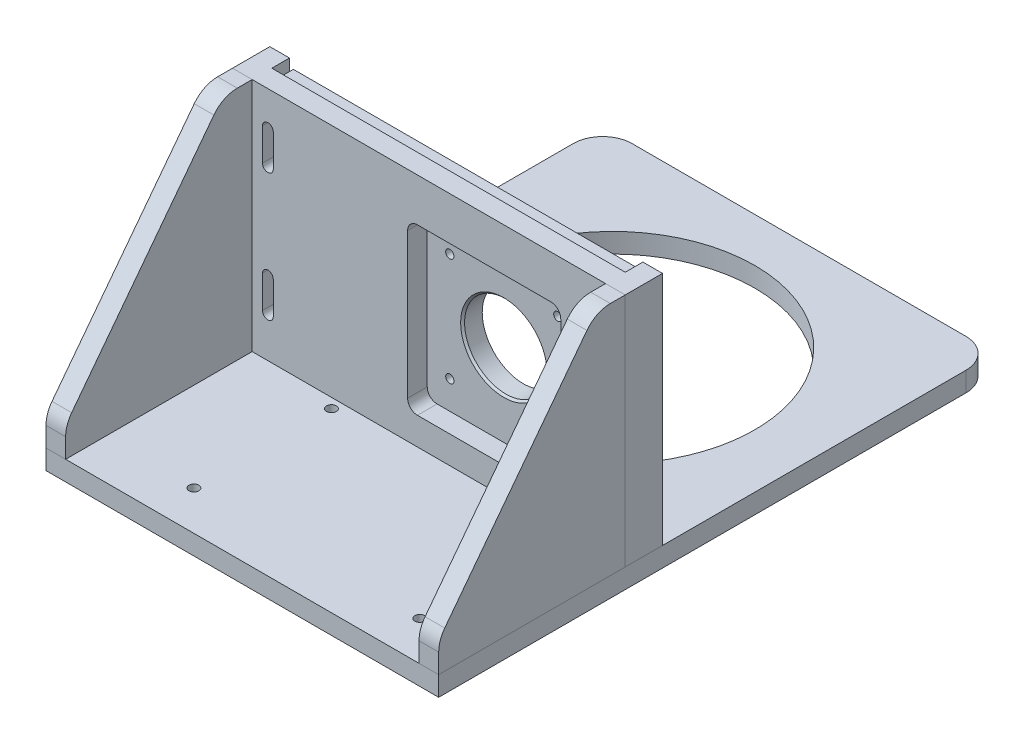
from build123d import *

# Parameters (mm, degrees)
SKETCH1_W                                            = 200
SKETCH1_H                                            = 283.5
SKETCH1_R                                            = 72.5
SKETCH1_R_2                                          = 0.5
BOSS_EXTRUDE1_DEPTH                                  = 10
M6_TAPPED_HOLE1_D                                    = 5
CSK_FOR_M5_HEX_SOCKET_COUNTERSUNK_CAP_SC_D           = 5.5
CSK_FOR_M5_HEX_SOCKET_COUNTERSUNK_CAP_SC_CSINK_D     = 11.2
CSK_FOR_M5_HEX_SOCKET_COUNTERSUNK_CAP_SC_CSINK_ANGLE = 90
SKETCH7_W                                            = 200
SKETCH7_H                                            = 10
BOSS_EXTRUDE2_DEPTH                                  = 120
BOSS_EXTRUDE3_DEPTH                                  = 10
SKETCH22_W                                           = 10
SKETCH22_H                                           = 120
BOSS_EXTRUDE4_DEPTH                                  = 10
SKETCH12_W                                           = 2.25
SKETCH12_H                                           = 115
M4_CLEARANCE_HOLE1_AT_2_COUNT                        = 2
M4_CLEARANCE_HOLE1_AT_2_PITCH                        = 45
M4_CLEARANCE_HOLE1_AT_3_COUNT                        = 2
M4_CLEARANCE_HOLE1_AT_3_PITCH                        = 90
CSK_FOR_M4_HEX_SOCKET_COUNTERSUNK_CA_2_COUNT         = 2
CSK_FOR_M4_HEX_SOCKET_COUNTERSUNK_CA_2_PITCH         = 35
CSK_FOR_M4_HEX_SOCKET_COUNTERSUNK_CA_3_COUNT         = 2
CSK_FOR_M4_HEX_SOCKET_COUNTERSUNK_CA_3_PITCH         = 70
M4_TAPPED_HOLE1_AT_2_COUNT                           = 2
M4_TAPPED_HOLE1_AT_2_PITCH                           = 45
M4_TAPPED_HOLE1_AT_3_COUNT                           = 2
M4_TAPPED_HOLE1_AT_3_PITCH                           = 90
M4_TAPPED_HOLE2_AT_2_COUNT                           = 2
M4_TAPPED_HOLE2_AT_2_PITCH                           = 35
M4_TAPPED_HOLE2_AT_3_COUNT                           = 2
M4_TAPPED_HOLE2_AT_3_PITCH                           = 70
M5_TAPPED_HOLE1_AT_2_COUNT                           = 2
M5_TAPPED_HOLE1_AT_2_PITCH                           = 75
M5_TAPPED_HOLE1_AT_3_COUNT                           = 2
M5_TAPPED_HOLE1_AT_3_PITCH                           = 150
FILLET2_R                                            = 15
MIRROR2_COPY_1_SKETCH_W                              = 2.25
MIRROR2_COPY_1_SKETCH_H                              = 115
MIRROR2_COPY_2_SKETCH_W                              = 2.25
MIRROR2_COPY_2_SKETCH_H                              = 115
SKETCH21_W                                           = 78
SKETCH21_H                                           = 84
CUT_EXTRUDE1_DEPTH                                   = 250.86446326
SKETCH23_W                                           = 180
SKETCH23_H                                           = 110
BOSS_EXTRUDE5_DEPTH                                  = 10
M5_START                                             = 83.5
M5_CLEARANCE_SLOT1_DEPTH                             = 10
SKETCH27_W                                           = 2.1
SKETCH27_H                                           = 178.5
M5_TAPPED_HOLE2_AT_2_COUNT                           = 2
M5_TAPPED_HOLE2_AT_2_PITCH                           = 65
M5_TAPPED_HOLE2_AT_3_COUNT                           = 2
M5_TAPPED_HOLE2_AT_3_PITCH                           = 164
M5_TAPPED_HOLE2_AT_4_COUNT                           = 2
M5_TAPPED_HOLE2_AT_4_PITCH                           = 176.411450876
CSK_FOR_M6_HEX_SOCKET_COUNTERSUNK_CA_2_COUNT         = 2
CSK_FOR_M6_HEX_SOCKET_COUNTERSUNK_CA_2_PITCH         = 95.25
CSK_FOR_M6_HEX_SOCKET_COUNTERSUNK_CA_3_COUNT         = 2
CSK_FOR_M6_HEX_SOCKET_COUNTERSUNK_CA_3_PITCH         = 118.205594199
CSK_FOR_M6_HEX_SOCKET_COUNTERSUNK_CA_4_COUNT         = 2
CSK_FOR_M6_HEX_SOCKET_COUNTERSUNK_CA_4_PITCH         = 70
SKETCH32_W                                           = 2.1
SKETCH32_H                                           = 178.5
M5_TAPPED_HOLE3_AT_2_COUNT                           = 2
M5_TAPPED_HOLE3_AT_2_PITCH                           = 55
M5_TAPPED_HOLE3_AT_3_COUNT                           = 2
M5_TAPPED_HOLE3_AT_3_PITCH                           = 55
M5_TAPPED_HOLE3_AT_4_COUNT                           = 2
M5_TAPPED_HOLE3_AT_4_PITCH                           = 77.781745931
SKETCH33_R                                           = 21
CUT_EXTRUDE2_DEPTH                                   = 243.409261374
SKETCH35_W                                           = 3
SKETCH35_H                                           = 178.5
F_6_0MM_DOWEL_HOLE1_AT_2_COUNT                       = 2
F_6_0MM_DOWEL_HOLE1_AT_2_PITCH                       = 95.25
FILLET1_R                                            = 15
FILLET3_R                                            = 5
CHAMFER1_SIZE                                        = 1
CHAMFER2_SIZE                                        = 1
CHAMFER3_SIZE                                        = 1
CHAMFER4_SIZE                                        = 1


# Read off the part's stored shape, not the designer's step: M5 Clearance Slot1
with BuildPart() as part:
    # Sketch1 → Boss-Extrude1 (new body)
    with BuildSketch(Plane(origin=(0, 0, 0), x_dir=(1, 0, 0), z_dir=(0, 1, 0))):
        with Locations((0, -46.75)):
            Rectangle(SKETCH1_W, SKETCH1_H)
        with Locations(Location((0, 0, 0), (0, 0, 270))):
            Circle(SKETCH1_R, mode=Mode.SUBTRACT)
        with Locations(Location((-44.65, -168.5, 0), (0, 0, 270))):
            Circle(SKETCH1_R_2, mode=Mode.SUBTRACT)
        with Locations(Location((70.35, -168.5, 0), (0, 0, 270))):
            Circle(SKETCH1_R_2, mode=Mode.SUBTRACT)
        with Locations(Location((70.35, -98.5, 0), (0, 0, 270))):
            Circle(SKETCH1_R_2, mode=Mode.SUBTRACT)
        with Locations(Location((-44.65, -98.5, 0), (0, 0, 270))):
            Circle(SKETCH1_R_2, mode=Mode.SUBTRACT)
    extrude(amount=BOSS_EXTRUDE1_DEPTH)

    # M6 Tapped Hole1 (through all)
    with Locations(Plane(origin=(0, 10, 0), x_dir=(1, 0, 0), z_dir=(0, 1, 0))):
        with Locations((-44.65, -98.5), (-44.65, -168.5), (70.35, -168.5), (70.35, -98.5)):
            Hole(M6_TAPPED_HOLE1_D / 2)

    # CSK for M5 Hex Socket Countersunk Cap Screw2 (through all)
    with Locations(Plane(origin=(0, 0, 0), x_dir=(-1, 0, 0), z_dir=(0, -1, 0))):
        with Locations((0, -88.5), (75, -88.5), (-75, -88.5)):
            CounterSinkHole(CSK_FOR_M5_HEX_SOCKET_COUNTERSUNK_CAP_SC_D / 2, CSK_FOR_M5_HEX_SOCKET_COUNTERSUNK_CAP_SC_CSINK_D / 2, counter_sink_angle=CSK_FOR_M5_HEX_SOCKET_COUNTERSUNK_CAP_SC_CSINK_ANGLE)

    # Sketch14 → CSK for M4 Hex Socket Countersunk Cap Screw1 (revolve, cut)
    with BuildSketch(Plane(origin=(-95, 0, 178.5), x_dir=(0, 0, -1), z_dir=(1, 0, 0))):
        Polygon((0, 0), (0, 130), (2.25, 130), (2.25, 2.23), (4.48, 0), align=None)
    csk_for_m4_hex_socket_countersunk_cap_sc = revolve(axis=Axis((-95, -6.35, 178.5), (0, 1, 0)), mode=Mode.SUBTRACT)

    # CSK for M4 Hex Socket Countersunk Ca 2: CSK for M4 Hex Socket Countersunk Cap Screw1 ×2
    with Locations(*[(0, 0, -i * CSK_FOR_M4_HEX_SOCKET_COUNTERSUNK_CA_2_PITCH) for i in range(1, CSK_FOR_M4_HEX_SOCKET_COUNTERSUNK_CA_2_COUNT)]):
        add(csk_for_m4_hex_socket_countersunk_cap_sc, mode=Mode.SUBTRACT)

    # CSK for M4 Hex Socket Countersunk Ca 3: CSK for M4 Hex Socket Countersunk Cap Screw1 ×2
    with Locations(*[(0, 0, -i * CSK_FOR_M4_HEX_SOCKET_COUNTERSUNK_CA_3_PITCH) for i in range(1, CSK_FOR_M4_HEX_SOCKET_COUNTERSUNK_CA_3_COUNT)]):
        add(csk_for_m4_hex_socket_countersunk_cap_sc, mode=Mode.SUBTRACT)


with BuildPart() as body_2:
    # Sketch7 → Boss-Extrude2 (new body)
    with BuildSketch(Plane(origin=(0, 10, 0), x_dir=(1, 0, 0), z_dir=(0, 1, 0))):
        with Locations((0, -88.5)):
            Rectangle(SKETCH7_W, SKETCH7_H)
    extrude(amount=BOSS_EXTRUDE2_DEPTH)

    # Sketch22 → Boss-Extrude4 (add)
    with BuildSketch(Plane(origin=(0, 0, 83.5), x_dir=(-1, 0, 0), z_dir=(0, 0, -1))):
        with Locations((95, 70)):
            Rectangle(SKETCH22_W, SKETCH22_H)
    boss_extrude4 = extrude(amount=BOSS_EXTRUDE4_DEPTH)

    # Sketch12 → M4 Clearance Hole1 (revolve, cut)
    with BuildSketch(Plane(origin=(-95, 115, 73.5), x_dir=(0, 1, 0), z_dir=(1, 0, 0))):
        with Locations((1.125, 57.5)):
            Rectangle(SKETCH12_W, SKETCH12_H)
    m4_clearance_hole1 = revolve(axis=Axis((-95, 115, 67.15), (0, 0, 1)), mode=Mode.SUBTRACT)

    # M4 Clearance Hole1 at 2: M4 Clearance Hole1 ×2
    with Locations(*[(0, -i * M4_CLEARANCE_HOLE1_AT_2_PITCH, 0) for i in range(1, M4_CLEARANCE_HOLE1_AT_2_COUNT)]):
        add(m4_clearance_hole1, mode=Mode.SUBTRACT)

    # M4 Clearance Hole1 at 3: M4 Clearance Hole1 ×2
    with Locations(*[(0, -i * M4_CLEARANCE_HOLE1_AT_3_PITCH, 0) for i in range(1, M4_CLEARANCE_HOLE1_AT_3_COUNT)]):
        add(m4_clearance_hole1, mode=Mode.SUBTRACT)

    # Sketch20 → M5 Tapped Hole1 (revolve, cut)
    with BuildSketch(Plane(origin=(-75, 10, 88.5), x_dir=(0, 0, -1), z_dir=(1, 0, 0))):
        Polygon((0, 0), (0, 13.6618073), (2.1, 12.4), (2.1, 0), align=None)
    m5_tapped_hole1 = revolve(axis=Axis((-75, 3.65, 88.5), (0, 1, 0)), mode=Mode.SUBTRACT)

    # M5 Tapped Hole1 at 2: M5 Tapped Hole1 ×2
    with Locations(*[(i * M5_TAPPED_HOLE1_AT_2_PITCH, 0, 0) for i in range(1, M5_TAPPED_HOLE1_AT_2_COUNT)]):
        add(m5_tapped_hole1, mode=Mode.SUBTRACT)

    # M5 Tapped Hole1 at 3: M5 Tapped Hole1 ×2
    with Locations(*[(i * M5_TAPPED_HOLE1_AT_3_PITCH, 0, 0) for i in range(1, M5_TAPPED_HOLE1_AT_3_COUNT)]):
        add(m5_tapped_hole1, mode=Mode.SUBTRACT)

    # Mirror3: Boss-Extrude4 across plane
    add(boss_extrude4.mirror(Plane(origin=(0, 0, 0), x_dir=(0, 0, 1), z_dir=(1, 0, 0))))


with BuildPart() as body_3:
    # Sketch10 → Boss-Extrude3 (new body)
    with BuildSketch(Plane.ZY.offset(100)):
        Polygon((93.5, 130), (93.5, 10), (188.5, 10), (188.5, 25), (108.5, 130), align=None)
    extrude(amount=-BOSS_EXTRUDE3_DEPTH)

    # Sketch16 → M4 Tapped Hole1 (revolve, cut)
    with BuildSketch(Plane(origin=(-95, 115, 93.5), x_dir=(0, 1, 0), z_dir=(1, 0, 0))):
        Polygon((0, 0), (0, 11.091420021), (1.65, 10.1), (1.65, 0), align=None)
    m4_tapped_hole1 = revolve(axis=Axis((-95, 115, 87.15), (0, 0, 1)), mode=Mode.SUBTRACT)

    # M4 Tapped Hole1 at 2: M4 Tapped Hole1 ×2
    with Locations(*[(0, -i * M4_TAPPED_HOLE1_AT_2_PITCH, 0) for i in range(1, M4_TAPPED_HOLE1_AT_2_COUNT)]):
        add(m4_tapped_hole1, mode=Mode.SUBTRACT)

    # M4 Tapped Hole1 at 3: M4 Tapped Hole1 ×2
    with Locations(*[(0, -i * M4_TAPPED_HOLE1_AT_3_PITCH, 0) for i in range(1, M4_TAPPED_HOLE1_AT_3_COUNT)]):
        add(m4_tapped_hole1, mode=Mode.SUBTRACT)

    # Sketch18 → M4 Tapped Hole2 (revolve, cut)
    with BuildSketch(Plane(origin=(-95, 10, 108.5), x_dir=(0, 0, -1), z_dir=(1, 0, 0))):
        Polygon((0, 0), (0, 11.091420021), (1.65, 10.1), (1.65, 0), align=None)
    m4_tapped_hole2 = revolve(axis=Axis((-95, 3.65, 108.5), (0, 1, 0)), mode=Mode.SUBTRACT)

    # M4 Tapped Hole2 at 2: M4 Tapped Hole2 ×2
    with Locations(*[(0, 0, i * M4_TAPPED_HOLE2_AT_2_PITCH) for i in range(1, M4_TAPPED_HOLE2_AT_2_COUNT)]):
        add(m4_tapped_hole2, mode=Mode.SUBTRACT)

    # M4 Tapped Hole2 at 3: M4 Tapped Hole2 ×2
    with Locations(*[(0, 0, i * M4_TAPPED_HOLE2_AT_3_PITCH) for i in range(1, M4_TAPPED_HOLE2_AT_3_COUNT)]):
        add(m4_tapped_hole2, mode=Mode.SUBTRACT)

    # Fillet2
    fillet2_edges = [body_3.edges().sort_by_distance(p)[0] for p in [
        (-95, 130, 108.5),
        (-95, 25, 188.5),
    ]]
    fillet(fillet2_edges, radius=FILLET2_R)


with BuildPart() as body_4:
    # Mirror1: mirrored copy
    add(body_3.part.mirror(Plane(origin=(0, 0, 0), x_dir=(0, 0, 1), z_dir=(1, 0, 0))))


with BuildPart() as mirror2_tool:
    # Mirror2: M4 Clearance Hole1, CSK for M4 Hex Socket Countersunk Cap Screw1 across plane
    add(m4_clearance_hole1.mirror(Plane(origin=(0, 0, 0), x_dir=(0, 0, 1), z_dir=(1, 0, 0))))
    add(csk_for_m4_hex_socket_countersunk_cap_sc.mirror(Plane(origin=(0, 0, 0), x_dir=(0, 0, 1), z_dir=(1, 0, 0))))


with BuildPart() as body_2_1:
    add(body_2.part)

    # Mirror2: cut by mirror2_tool
    add(mirror2_tool.part, mode=Mode.SUBTRACT)

    # Mirror2 copy 1 sketch → Mirror2 copy 1 (revolve, cut)
    with BuildSketch(Plane(origin=(95, 70, 73.5), x_dir=(0, 1, 0), z_dir=(-1, 0, 0))):
        with Locations((1.125, -57.5)):
            Rectangle(MIRROR2_COPY_1_SKETCH_W, MIRROR2_COPY_1_SKETCH_H)
    revolve(axis=Axis((95, 70, 67.15), (0, 0, -1)), mode=Mode.SUBTRACT)

    # Mirror2 copy 2 sketch → Mirror2 copy 2 (revolve, cut)
    with BuildSketch(Plane(origin=(95, 25, 73.5), x_dir=(0, 1, 0), z_dir=(-1, 0, 0))):
        with Locations((1.125, -57.5)):
            Rectangle(MIRROR2_COPY_2_SKETCH_W, MIRROR2_COPY_2_SKETCH_H)
    revolve(axis=Axis((95, 25, 67.15), (0, 0, -1)), mode=Mode.SUBTRACT)

    # Sketch21 → Cut-Extrude1 (cut, through all)
    with BuildSketch(Plane.XY.offset(93.5)):
        with Locations((28.17, 66)):
            Rectangle(SKETCH21_W, SKETCH21_H)
    extrude(amount=-CUT_EXTRUDE1_DEPTH, mode=Mode.SUBTRACT)

    # M5 Clearance Slot1 outline → M5 Clearance Slot1 (cut)
    with BuildSketch(Plane.XY.offset(M5_START)):
        with BuildLine():
            Line((-79.25, 30.75), (-79.25, 47.25))
            ThreePointArc((-79.25, 47.25), (-82, 50), (-84.75, 47.25))
            Line((-84.75, 47.25), (-84.75, 30.75))
            ThreePointArc((-84.75, 30.75), (-82, 28), (-79.25, 30.75))
        make_face()
        with BuildLine():
            ThreePointArc((-79.25, 112.25), (-82, 115), (-84.75, 112.25))
            Line((-84.75, 112.25), (-84.75, 95.75))
            ThreePointArc((-84.75, 95.75), (-82, 93), (-79.25, 95.75))
            Line((-79.25, 95.75), (-79.25, 112.25))
        make_face()
        with BuildLine():
            Line((84.75, 30.75), (84.75, 47.25))
            ThreePointArc((84.75, 47.25), (82, 50), (79.25, 47.25))
            Line((79.25, 47.25), (79.25, 30.75))
            ThreePointArc((79.25, 30.75), (82, 28), (84.75, 30.75))
        make_face()
        with BuildLine():
            ThreePointArc((84.75, 112.25), (82, 115), (79.25, 112.25))
            Line((79.25, 112.25), (79.25, 95.75))
            ThreePointArc((79.25, 95.75), (82, 93), (84.75, 95.75))
            Line((84.75, 95.75), (84.75, 112.25))
        make_face()
    extrude(amount=M5_CLEARANCE_SLOT1_DEPTH, mode=Mode.SUBTRACT)

    # Fillet3
    fillet3_edges = [body_2_1.edges().sort_by_distance(p)[0] for p in [
        (-10.83, 24, 88.5),
        (-10.83, 108, 88.5),
        (67.17, 108, 88.5),
        (67.17, 24, 88.5),
    ]]
    fillet(fillet3_edges, radius=FILLET3_R)

    # Chamfer2
    chamfer2_edges = [body_2_1.edges().sort_by_distance(p)[0] for p in [
        (-100, 70, 73.5),
        (-90, 70, 73.5),
        (100, 70, 73.5),
        (90, 70, 73.5),
    ]]
    chamfer(chamfer2_edges, length=CHAMFER2_SIZE)

    # Chamfer4
    chamfer4_edges = [body_2_1.edges().sort_by_distance(p)[0] for p in [
        (-95, 130, 73.5),
        (95, 130, 73.5),
    ]]
    chamfer(chamfer4_edges, length=CHAMFER4_SIZE)


with BuildPart() as part_1:
    add(part.part)

    # Mirror2: cut by mirror2_tool
    add(mirror2_tool.part, mode=Mode.SUBTRACT)

    # Mirror2 copy 3 sketch → Mirror2 copy 3 (revolve, cut)
    with BuildSketch(Plane(origin=(95, 0, 143.5), x_dir=(0, 0, -1), z_dir=(-1, 0, 0))):
        Polygon((0, 0), (0, -130), (2.25, -130), (2.25, -2.23), (4.48, 0), align=None)
    revolve(axis=Axis((95, -6.35, 143.5), (0, -1, 0)), mode=Mode.SUBTRACT)

    # Mirror2 copy 4 sketch → Mirror2 copy 4 (revolve, cut)
    with BuildSketch(Plane(origin=(95, 0, 108.5), x_dir=(0, 0, -1), z_dir=(-1, 0, 0))):
        Polygon((0, 0), (0, -130), (2.25, -130), (2.25, -2.23), (4.48, 0), align=None)
    revolve(axis=Axis((95, -6.35, 108.5), (0, -1, 0)), mode=Mode.SUBTRACT)

    # Fillet1
    fillet1_edges = [part_1.edges().sort_by_distance(p)[0] for p in [
        (-100, 5, -95),
        (100, 5, -95),
    ]]
    fillet(fillet1_edges, radius=FILLET1_R)


with BuildPart() as body_5:
    # Sketch23 → Boss-Extrude5 (new body)
    with BuildSketch(Plane(origin=(0, 0, 83.5), x_dir=(-1, 0, 0), z_dir=(0, 0, -1))):
        with Locations((0, 70)):
            Rectangle(SKETCH23_W, SKETCH23_H)
    extrude(amount=BOSS_EXTRUDE5_DEPTH)

    # Sketch27 → M5 Tapped Hole2 (revolve, cut)
    with BuildSketch(Plane(origin=(-82, 104, 83.5), x_dir=(0, -1, 0), z_dir=(1, 0, 0))):
        with Locations((1.05, 89.25)):
            Rectangle(SKETCH27_W, SKETCH27_H)
    m5_tapped_hole2 = revolve(axis=Axis((-82, 104, 89.85), (0, 0, -1)), mode=Mode.SUBTRACT)

    # M5 Tapped Hole2 at 2: M5 Tapped Hole2 ×2
    with Locations(*[(0, -i * M5_TAPPED_HOLE2_AT_2_PITCH, 0) for i in range(1, M5_TAPPED_HOLE2_AT_2_COUNT)]):
        add(m5_tapped_hole2, mode=Mode.SUBTRACT)

    # M5 Tapped Hole2 at 3: M5 Tapped Hole2 ×2
    with Locations(*[(i * M5_TAPPED_HOLE2_AT_3_PITCH, 0, 0) for i in range(1, M5_TAPPED_HOLE2_AT_3_COUNT)]):
        add(m5_tapped_hole2, mode=Mode.SUBTRACT)

    # M5 Tapped Hole2 at 4: M5 Tapped Hole2 ×2
    with Locations(*[Vector(0.929644868210613, -0.3684568075224992, 0) * (i * M5_TAPPED_HOLE2_AT_4_PITCH) for i in range(1, M5_TAPPED_HOLE2_AT_4_COUNT)]):
        add(m5_tapped_hole2, mode=Mode.SUBTRACT)

    # Sketch30 → CSK for M6 Hex Socket Countersunk Cap Screw1 (revolve, cut)
    with BuildSketch(Plane(origin=(66.27, 30.86, 83.5), x_dir=(0, -1, 0), z_dir=(1, 0, 0))):
        Polygon((0, 0), (0, 178.5), (3.3, 178.5), (3.3, 3.42), (6.72, 0), align=None)
    csk_for_m6_hex_socket_countersunk_cap_sc = revolve(axis=Axis((66.27, 30.86, 89.85), (0, 0, -1)), mode=Mode.SUBTRACT)

    # CSK for M6 Hex Socket Countersunk Ca 2: CSK for M6 Hex Socket Countersunk Cap Screw1 ×2
    with Locations(*[(-i * CSK_FOR_M6_HEX_SOCKET_COUNTERSUNK_CA_2_PITCH, 0, 0) for i in range(1, CSK_FOR_M6_HEX_SOCKET_COUNTERSUNK_CA_2_COUNT)]):
        add(csk_for_m6_hex_socket_countersunk_cap_sc, mode=Mode.SUBTRACT)

    # CSK for M6 Hex Socket Countersunk Ca 3: CSK for M6 Hex Socket Countersunk Cap Screw1 ×2
    with Locations(*[Vector(-0.8057994263743293, 0.5921885548157798, 0) * (i * CSK_FOR_M6_HEX_SOCKET_COUNTERSUNK_CA_3_PITCH) for i in range(1, CSK_FOR_M6_HEX_SOCKET_COUNTERSUNK_CA_3_COUNT)]):
        add(csk_for_m6_hex_socket_countersunk_cap_sc, mode=Mode.SUBTRACT)

    # CSK for M6 Hex Socket Countersunk Ca 4: CSK for M6 Hex Socket Countersunk Cap Screw1 ×2
    with Locations(*[(0, i * CSK_FOR_M6_HEX_SOCKET_COUNTERSUNK_CA_4_PITCH, 0) for i in range(1, CSK_FOR_M6_HEX_SOCKET_COUNTERSUNK_CA_4_COUNT)]):
        add(csk_for_m6_hex_socket_countersunk_cap_sc, mode=Mode.SUBTRACT)

    # Sketch32 → M5 Tapped Hole3 (revolve, cut)
    with BuildSketch(Plane(origin=(0.67, 93.36, 83.5), x_dir=(0, -1, 0), z_dir=(1, 0, 0))):
        with Locations((1.05, 89.25)):
            Rectangle(SKETCH32_W, SKETCH32_H)
    m5_tapped_hole3 = revolve(axis=Axis((0.67, 93.36, 89.85), (0, 0, -1)), mode=Mode.SUBTRACT)

    # M5 Tapped Hole3 at 2: M5 Tapped Hole3 ×2
    with Locations(*[(i * M5_TAPPED_HOLE3_AT_2_PITCH, 0, 0) for i in range(1, M5_TAPPED_HOLE3_AT_2_COUNT)]):
        add(m5_tapped_hole3, mode=Mode.SUBTRACT)

    # M5 Tapped Hole3 at 3: M5 Tapped Hole3 ×2
    with Locations(*[(0, -i * M5_TAPPED_HOLE3_AT_3_PITCH, 0) for i in range(1, M5_TAPPED_HOLE3_AT_3_COUNT)]):
        add(m5_tapped_hole3, mode=Mode.SUBTRACT)

    # M5 Tapped Hole3 at 4: M5 Tapped Hole3 ×2
    with Locations(*[Vector(0.7071067811865528, -0.7071067811865422, 0) * (i * M5_TAPPED_HOLE3_AT_4_PITCH) for i in range(1, M5_TAPPED_HOLE3_AT_4_COUNT)]):
        add(m5_tapped_hole3, mode=Mode.SUBTRACT)

    # Sketch33 → Cut-Extrude2 (cut, through all)
    with BuildSketch(Plane.XY.offset(83.5)):
        with Locations((28.17, 65.86)):
            Circle(SKETCH33_R)
    extrude(amount=-CUT_EXTRUDE2_DEPTH, mode=Mode.SUBTRACT)

    # Sketch35 → Ø6.0mm Dowel Hole1 (revolve, cut)
    with BuildSketch(Plane(origin=(-28.98, 65.86, 83.5), x_dir=(0, -1, 0), z_dir=(1, 0, 0))):
        with Locations((1.5, 89.25)):
            Rectangle(SKETCH35_W, SKETCH35_H)
    f_6_0mm_dowel_hole1 = revolve(axis=Axis((-28.98, 65.86, 89.85), (0, 0, -1)), mode=Mode.SUBTRACT)

    # Ø6.0mm Dowel Hole1 at 2: Ø6.0mm Dowel Hole1 ×2
    with Locations(*[(i * F_6_0MM_DOWEL_HOLE1_AT_2_PITCH, 0, 0) for i in range(1, F_6_0MM_DOWEL_HOLE1_AT_2_COUNT)]):
        add(f_6_0mm_dowel_hole1, mode=Mode.SUBTRACT)

    # Chamfer1
    chamfer1_edges = [body_5.edges().sort_by_distance(p)[0] for p in [
        (7.17, 65.86, 83.5),
    ]]
    chamfer(chamfer1_edges, length=CHAMFER1_SIZE)

    # Chamfer3
    chamfer3_edges = [body_5.edges().sort_by_distance(p)[0] for p in [
        (90, 125, 78.5),
        (-90, 125, 78.5),
        (-90, 15, 78.5),
        (90, 15, 78.5),
    ]]
    chamfer(chamfer3_edges, length=CHAMFER3_SIZE)


solid = Compound([body_3.part, body_4.part, body_2_1.part, part_1.part, body_5.part])
